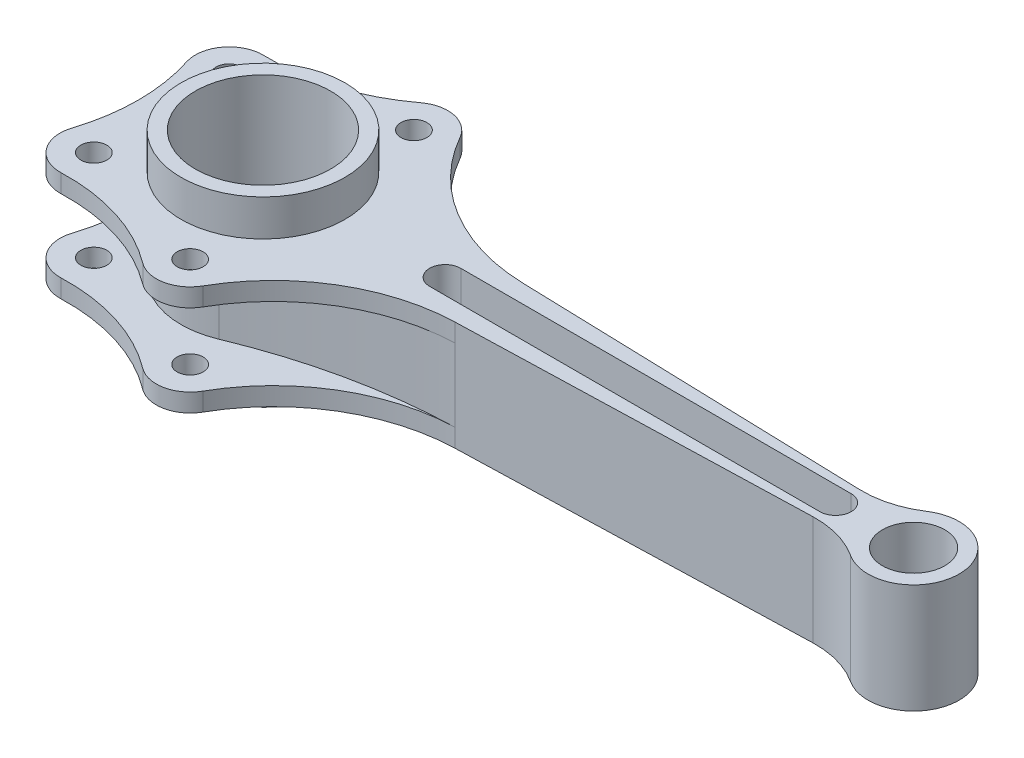
from build123d import *

# Parameters (mm, degrees)
BOSS_EXTRUDE1_DEPTH   = 21
CUT_EXTRUDE1_START    = -14
CUT_EXTRUDE1_DEPTH    = 14
BOSS_EXTRUDE2_START   = -35
BOSS_EXTRUDE2_DEPTH   = 35
SKETCH5_R             = 26
SKETCH5_R_2           = 12
CUT_EXTRUDE2_DEPTH    = 276.530851267
CUT_EXTRUDE3_DEPTH    = 18.5
F_1_0MM_DOWEL_HOLE1_D = 10


# Read off the part's stored shape, not the designer's step: Cut-Extrude1
with BuildPart() as part:
    # Sketch1 → Boss-Extrude1 (new body)
    with BuildSketch(Plane(origin=(0, 0, 0), x_dir=(1, 0, 0), z_dir=(0, 1, 0))):
        with BuildLine():
            Line((86.761016473, 13), (220.287888894, 9))
            ThreePointArc((220.287888894, 9), (230.799852276, 10.288111331), (240.44529895, 14.661435395))
            ThreePointArc((240.44529895, 14.661435395), (267.5, 0), (240.44529895, -14.661435395))
            ThreePointArc((240.44529895, -14.661435395), (230.799852276, -10.288111331), (220.287888894, -9))
            Line((220.287888894, -9), (86.761016473, -13))
            ThreePointArc((86.761016473, -13), (51.764556155, -23.293555937), (26.304940485, -49.418591795))
            ThreePointArc((26.304940485, -49.418591795), (17.645869205, -55.727897554), (7.189691393, -53.392260556))
            ThreePointArc((7.189691393, -53.392260556), (-14.44681941, -42.272249892), (-38.551485077, -38.992260556))
            ThreePointArc((-38.551485077, -38.992260556), (-49.370923708, -33.838618593), (-51.376901133, -22.023529412))
            ThreePointArc((-51.376901133, -22.023529412), (-47.925892025, 0), (-51.376901133, 22.023529412))
            ThreePointArc((-51.376901133, 22.023529412), (-49.370923708, 33.838618593), (-38.551485077, 38.992260556))
            ThreePointArc((-38.551485077, 38.992260556), (-14.44681941, 42.272249892), (7.189691393, 53.392260556))
            ThreePointArc((7.189691393, 53.392260556), (17.645869205, 55.727897554), (26.304940485, 49.418591795))
            ThreePointArc((26.304940485, 49.418591795), (51.764556155, 23.293555937), (86.761016473, 13))
        make_face()
    extrude(amount=BOSS_EXTRUDE1_DEPTH)

    # Cut-Extrude1 outline → Cut-Extrude1 (cut)
    with BuildSketch(Plane.XZ.offset(CUT_EXTRUDE1_START)):
        with BuildLine():
            ThreePointArc((86.761016473, -13), (48.697663607, -17.630477543), (12.103585769, -29.081836454))
            ThreePointArc((12.103585769, -29.081836454), (-31.5, 0), (12.103585769, 29.081836454))
            ThreePointArc((12.103585769, 29.081836454), (48.697663607, 17.630477543), (86.761016473, 13))
            ThreePointArc((86.761016473, 13), (51.764556155, 23.293555937), (26.304940485, 49.418591795))
            ThreePointArc((26.304940485, 49.418591795), (17.645869204, 55.727897554), (7.189691393, 53.392260556))
            ThreePointArc((7.189691393, 53.392260556), (-14.446819411, 42.272249892), (-38.551485077, 38.992260556))
            ThreePointArc((-38.551485077, 38.992260556), (-49.370923708, 33.838618593), (-51.376901133, 22.023529412))
            ThreePointArc((-51.376901133, 22.023529412), (-47.925892025, 0), (-51.376901133, -22.023529412))
            ThreePointArc((-51.376901133, -22.023529412), (-49.370923708, -33.838618593), (-38.551485077, -38.992260556))
            ThreePointArc((-38.551485077, -38.992260556), (-14.446819411, -42.272249892), (7.189691393, -53.392260556))
            ThreePointArc((7.189691393, -53.392260556), (17.645869204, -55.727897554), (26.304940485, -49.418591795))
            ThreePointArc((26.304940485, -49.418591795), (51.764556155, -23.293555937), (86.761016473, -13))
        make_face()
    extrude(amount=CUT_EXTRUDE1_DEPTH, mode=Mode.SUBTRACT)

    # Sketch3 → Boss-Extrude2 (add)
    with BuildSketch(Plane.XZ.offset(BOSS_EXTRUDE2_START)):
        with BuildLine():
            ThreePointArc((12.103585769, -29.081836454), (26.20603892, -17.47837304), (31.5, 0))
            ThreePointArc((31.5, 0), (26.20603892, 17.47837304), (12.103585769, 29.081836454))
            ThreePointArc((12.103585769, 29.081836454), (-31.5, 0), (12.103585769, -29.081836454))
        make_face()
    extrude(amount=BOSS_EXTRUDE2_DEPTH)

    # Sketch5 → Cut-Extrude2 (cut, through all)
    with BuildSketch(Plane(origin=(0, 35, 0), x_dir=(1, 0, 0), z_dir=(0, 1, 0))):
        with Locations(Location((0, 0, 0), (0, 0, 270))):
            Circle(SKETCH5_R)
        with Locations(Location((250, 0, 0), (0, 0, 270))):
            Circle(SKETCH5_R_2)
    extrude(amount=-CUT_EXTRUDE2_DEPTH, mode=Mode.SUBTRACT)

    # Sketch6 → Cut-Extrude3 (cut)
    with BuildSketch(Plane(origin=(0, 21, 0), x_dir=(1, 0, 0), z_dir=(0, 1, 0))):
        with BuildLine():
            Line((70, 6), (220, 6))
            ThreePointArc((220, 6), (226, 0), (220, -6))
            Line((220, -6), (70, -6))
            ThreePointArc((70, -6), (64, 0), (70, 6))
        make_face()
    extrude(amount=-CUT_EXTRUDE3_DEPTH, mode=Mode.SUBTRACT)

    # Ø1.0mm Dowel Hole1 (through all)
    with Locations(Plane(origin=(15, 21, 43), x_dir=(0, 0, 1), z_dir=(0, 1, 0))):
        with Locations((0, 0)):
            f_1_0mm_dowel_hole1 = Hole(F_1_0MM_DOWEL_HOLE1_D / 2)

    # Sketch-Pattern1: Ø1.0mm Dowel Hole1 at 3 more places
    with Locations((-54, 0, -69), (-54, 0, -17), (0, 0, -86)):
        add(f_1_0mm_dowel_hole1, mode=Mode.SUBTRACT)

    # Mirror1: part across plane


with BuildPart() as part_1:
    add(part.part)
    add(part.part.mirror(Plane(origin=(-39, 0, -26), x_dir=(0, 0, 1), z_dir=(0, -1, 0))))


solid = part_1.part
